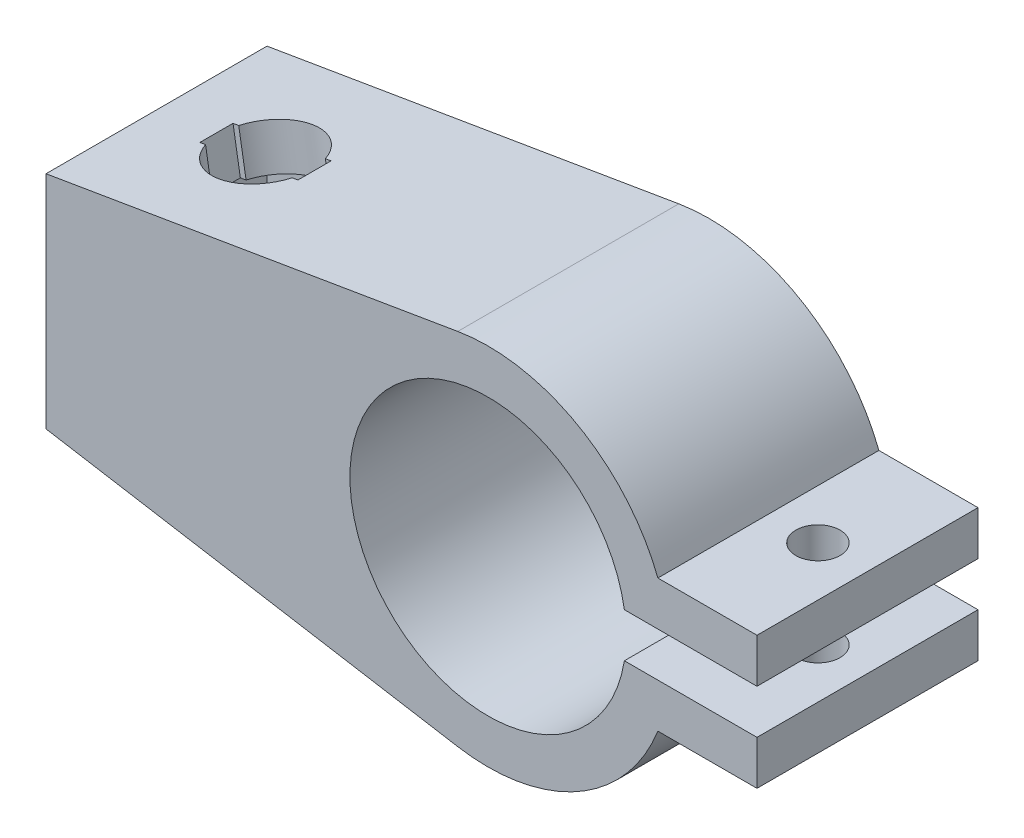
from build123d import *

# Parameters (mm, degrees)
SKETCH1_R               = 12.5
BOSS_EXTRUDE1_DEPTH     = 20
SHELL1_START            = 4
SHELL1_DEPTH            = 12
CUT_EXTRUDE1_DEPTH      = 5
CUT_EXTRUDE2_DEPTH      = 48.668123521
CUT_EXTRUDE2_DEPTH_BACK = 48.668123521
SKETCH5_W               = 12.044517282
SKETCH5_H               = 4
SKETCH6_W               = 12
SKETCH6_H               = 4
BOSS_EXTRUDE2_DEPTH     = 20
SKETCH7_R               = 2
CUT_EXTRUDE3_DEPTH      = 51.062460986


# Read off the part's stored shape, not the designer's step: Shell1
with BuildPart() as part:
    # Sketch1 → Boss-Extrude1 (new body)
    with BuildSketch(Plane.XY):
        with BuildLine():
            Line((-2.738458484, 16.271166066), (-40, 10))
            Line((-40, 10), (-40, -10))
            Line((-40, -10), (-2.738458484, -16.271166066))
            ThreePointArc((-2.738458484, -16.271166066), (16.5, 0), (-2.738458484, 16.271166066))
        make_face()
        Circle(SKETCH1_R, mode=Mode.SUBTRACT)
    extrude(amount=BOSS_EXTRUDE1_DEPTH)

    # Shell1 outline → Shell1 (cut)
    with BuildSketch(Plane.XY.offset(SHELL1_START)):
        with BuildLine():
            Line((-36, -10.67320522), (-2.738458484, -16.271166065))
            ThreePointArc((-2.738458484, -16.271166065), (-15.467708297, -5.744562646), (-12.695548653, 10.539119716))
            Line((-12.695548653, 10.539119716), (-36, 6.616950141))
            Line((-36, 6.616950141), (-36, -10.67320522))
        make_face()
    extrude(amount=SHELL1_DEPTH, mode=Mode.SUBTRACT)

    # Sketch4 → Cut-Extrude1 (cut)
    with BuildSketch(Plane(origin=(-2.738458484, 16.271166066, 0), x_dir=(0.9861312767016037, 0.16596718082459888, 0), z_dir=(-0.16596718082459888, 0.9861312767016037, 0))):
        with BuildLine():
            Line((-23.80908583, -8.5), (-23.28557926, -8.5))
            Line((-23.28557926, -8.5), (-23.28557926, -11.5))
            Line((-23.28557926, -11.5), (-23.80908583, -11.5))
            ThreePointArc((-23.80908583, -11.5), (-27.78557926, -14.25), (-31.76207269, -11.5))
            Line((-31.76207269, -11.5), (-32.28557926, -11.5))
            Line((-32.28557926, -11.5), (-32.28557926, -8.5))
            Line((-32.28557926, -8.5), (-31.76207269, -8.5))
            ThreePointArc((-31.76207269, -8.5), (-27.78557926, -5.75), (-23.80908583, -8.5))
        make_face()
    extrude(amount=-CUT_EXTRUDE1_DEPTH, mode=Mode.SUBTRACT)

    # Sketch5 → Cut-Extrude2 (cut, two sides: drawn at the far end of the back side and taken through both)
    with BuildSketch(Plane.XY.offset(20).offset(-CUT_EXTRUDE2_DEPTH_BACK)):
        with Locations((16.5, 0)):
            Rectangle(SKETCH5_W, SKETCH5_H)
    extrude(amount=CUT_EXTRUDE2_DEPTH + CUT_EXTRUDE2_DEPTH_BACK, mode=Mode.SUBTRACT)

    # Sketch6 → Boss-Extrude2 (add)
    with BuildSketch(Plane.XY.offset(20)):
        with Locations((18.338962679, -4)):
            Rectangle(SKETCH6_W, SKETCH6_H)
        with Locations((18.338962679, 4)):
            Rectangle(SKETCH6_W, SKETCH6_H)
    extrude(amount=-BOSS_EXTRUDE2_DEPTH)

    # Sketch7 → Cut-Extrude3 (cut, through all)
    with BuildSketch(Plane(origin=(0, 6, 0), x_dir=(1, 0, 0), z_dir=(0, 1, 0))):
        with Locations(Location((19.854694414, -10, 0), (0, 0, 270))):
            Circle(SKETCH7_R)
    extrude(amount=-CUT_EXTRUDE3_DEPTH, mode=Mode.SUBTRACT)


solid = part.part
